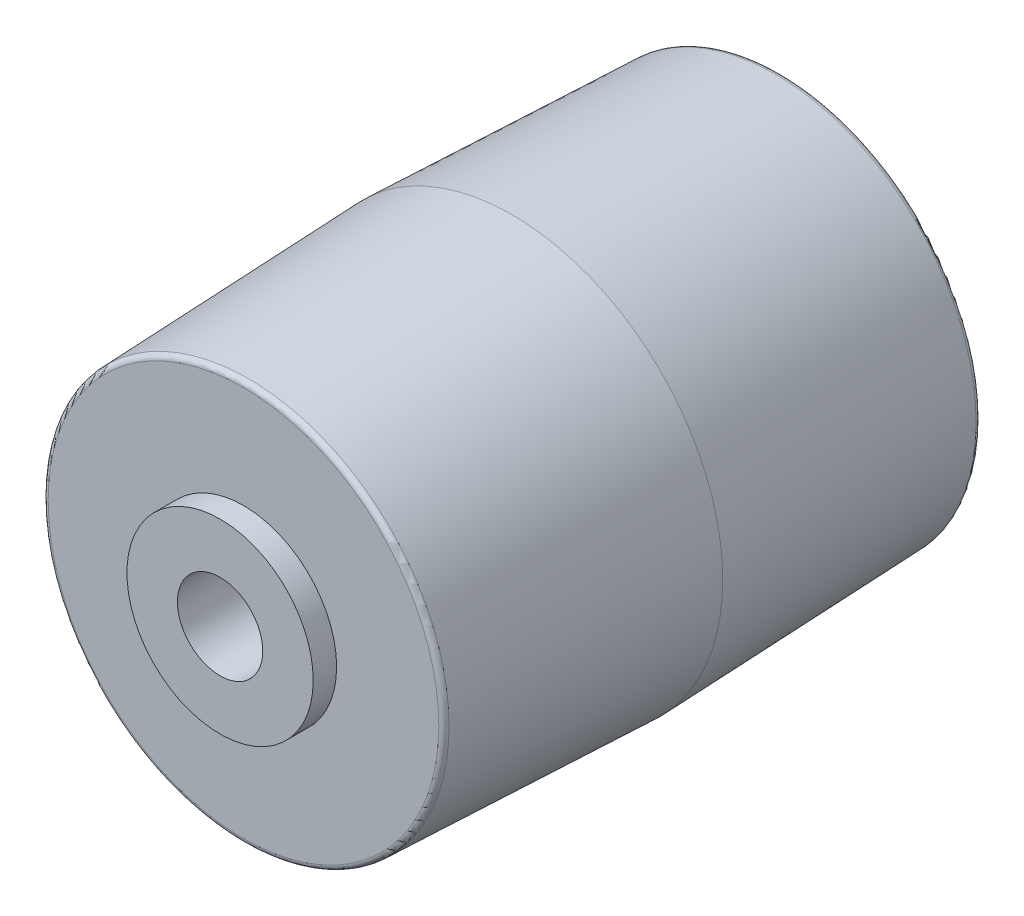
from build123d import *

# Parameters (mm, degrees)
SKETCH2_R          = 1.0414
CUT_EXTRUDE1_DEPTH = 16.998643219
FILLET1_R          = 0.127


with BuildPart() as part:
    # Sketch1 → Revolve1 (revolve)
    with BuildSketch(Plane(origin=(0, 0, 0), x_dir=(0, 0, -1), z_dir=(1, 0, 0))):
        Polygon((-7.1247, 0), (-7.1247, 2.2733), (-6.5532, 2.2733), (-6.5532, 4.8895), (0, 5.1435), (6.5532, 4.8895), (6.5532, 2.2733), (7.1247, 2.2733), (7.1247, 0), align=None)
    revolve(axis=Axis((0, 0, 7.1247), (0, 0, -1)))

    # Sketch2 → Cut-Extrude1 (cut, through all)
    with BuildSketch(Plane.XY.offset(7.1247)):
        Circle(SKETCH2_R)
    extrude(amount=-CUT_EXTRUDE1_DEPTH, mode=Mode.SUBTRACT)

    # Fillet1
    fillet1_edges = [part.edges().sort_by_distance(p)[0] for p in [
        (0, -4.8895, 6.5532),
        (0, -4.8895, -6.5532),
    ]]
    fillet(fillet1_edges, radius=FILLET1_R)


solid = part.part
